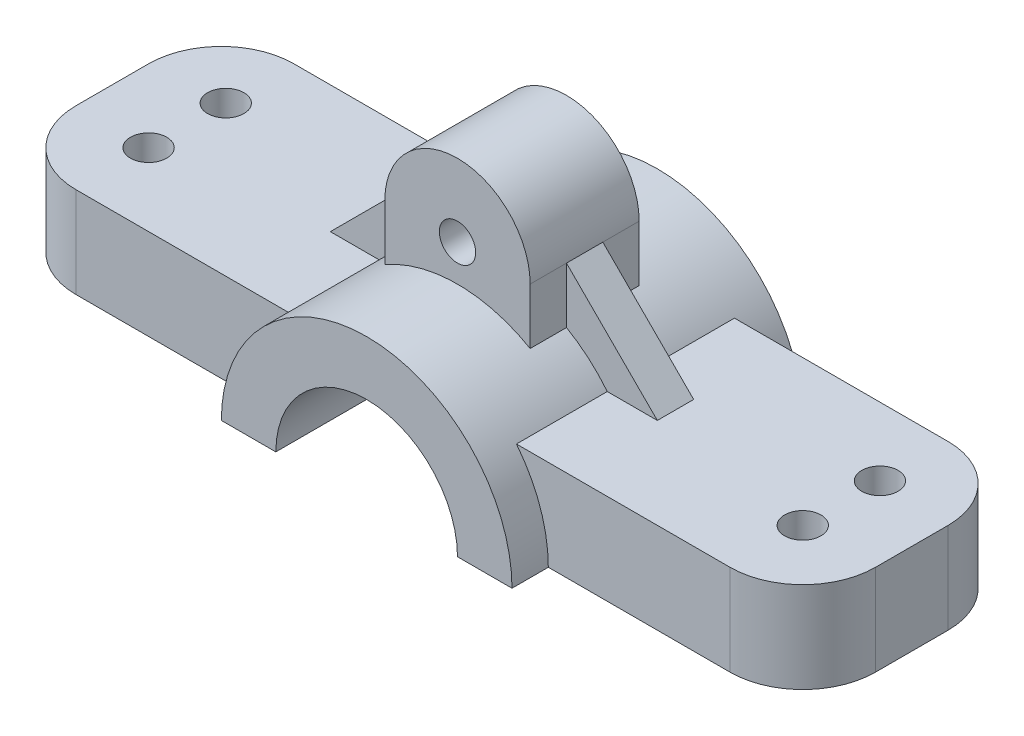
from build123d import *

# Parameters (mm, degrees)
BOSS_EXTRUDE1_DEPTH        = 40
SKETCH3_W                  = 100.026130685
SKETCH3_H                  = 60
BOSS_EXTRUDE2_DEPTH        = 25
FILLET1_R                  = 20
F_10_0_10_DIAMETER_HOLE1_D = 10
FILLET1_OF_MIRROR1_R       = 20
DELETEFACE1_START          = -30
DELETEFACE1_DEPTH          = 60
SKETCH16_R                 = 5
BOSS_EXTRUDE3_DEPTH        = 15
RIB1_REACH                 = 138.403
SKETCH18_WALL_W            = 310.161126634
SKETCH18_WALL_H            = 10


# Read off the part's stored shape, not the designer's step: DeleteFace1
with BuildPart() as part:
    # Sketch2 → Boss-Extrude1 (new, symmetric)
    with BuildSketch(Plane.XY):
        with BuildLine():
            Line((-40, 0), (-25, 0))
            ThreePointArc((-25, 0), (0, 25), (25, 0))
            Line((25, 0), (40, 0))
            ThreePointArc((40, 0), (0, 40), (-40, 0))
        make_face()
    extrude(amount=BOSS_EXTRUDE1_DEPTH, both=True)

    # Sketch3 → Boss-Extrude2 (add)
    with BuildSketch(Plane.XZ):
        with Locations((-60.013065343, 0)):
            Rectangle(SKETCH3_W, SKETCH3_H)
    boss_extrude2 = extrude(amount=-BOSS_EXTRUDE2_DEPTH)

    # Fillet1
    fillet1_edges = [part.edges().sort_by_distance(p)[0] for p in [
        (-110.026130685, 12.5, 30),
        (-110.026130685, 12.5, -30),
    ]]
    fillet(fillet1_edges, radius=FILLET1_R)

    # Ø10.0 (10) Diameter Hole1 (through all)
    with Locations(Plane(origin=(0, 25, 0), x_dir=(1, 0, 0), z_dir=(0, 1, 0))):
        with Locations((-90.026130685, -10), (-90.026130685, 11.237902365)):
            f_10_0_10_diameter_hole1 = Hole(F_10_0_10_DIAMETER_HOLE1_D / 2)

    # Mirror1: Boss-Extrude2, Ø10.0 (10) Diameter Hole1 across plane
    add(boss_extrude2.mirror(Plane(origin=(0, 0, 0), x_dir=(0, 0, 1), z_dir=(1, 0, 0))))
    add(f_10_0_10_diameter_hole1.mirror(Plane(origin=(0, 0, 0), x_dir=(0, 0, 1), z_dir=(1, 0, 0))), mode=Mode.SUBTRACT)

    # Fillet1 of Mirror1
    fillet1_of_mirror1_edges = [part.edges().sort_by_distance(p)[0] for p in [
        (110.026130685, 12.5, 30),
        (110.026130685, 12.5, -30),
    ]]
    fillet(fillet1_of_mirror1_edges, radius=FILLET1_OF_MIRROR1_R)

    # DeleteFace1 outline → DeleteFace1 (cut)
    with BuildSketch(Plane.XY.offset(DELETEFACE1_START)):
        with BuildLine():
            ThreePointArc((25, 0), (20.916500663, 13.693063938), (10, 22.912878475))
            Line((10, 22.912878475), (10, 0))
            Line((10, 0), (25, 0))
        make_face()
        with BuildLine():
            ThreePointArc((-10, 22.912878475), (-20.916500663, 13.693063938), (-25, 0))
            Line((-25, 0), (-10, 0))
            Line((-10, 0), (-10, 22.912878475))
        make_face()
    extrude(amount=DELETEFACE1_DEPTH, mode=Mode.SUBTRACT)

    # Sketch16 → Boss-Extrude3 (add, symmetric)
    with BuildSketch(Plane.XY):
        with BuildLine():
            ThreePointArc((20, 34.641016151), (0, 40), (-20, 34.641016151))
            Line((-20, 34.641016151), (-20, 50))
            ThreePointArc((-20, 50), (0, 70), (20, 50))
            Line((20, 50), (20, 34.641016151))
        make_face()
        with Locations((0, 50)):
            Circle(SKETCH16_R, mode=Mode.SUBTRACT)
    extrude(amount=BOSS_EXTRUDE3_DEPTH, both=True)

    # Sketch18 wall → Rib1 (add, up to next)
    with BuildSketch(Plane(origin=(-32.5, 37.5, 0), x_dir=(-0.707106781187, -0.707106781187, 0), z_dir=(0.707106781187, -0.707106781187, 0)), mode=Mode.PRIVATE) as rib1_sk1:
        Rectangle(SKETCH18_WALL_W, SKETCH18_WALL_H)
    rib1_tool1 = extrude(rib1_sk1.sketch, amount=RIB1_REACH, mode=Mode.PRIVATE) - part.part
    rib1 = rib1_tool1.solids().sort_by_distance((-32.5, 37.5, 0))[0]
    add(rib1)

    # Mirror2: Rib1 across plane
    add(rib1.mirror(Plane(origin=(0, 0, 0), x_dir=(0, 0, 1), z_dir=(1, 0, 0))))


solid = part.part
